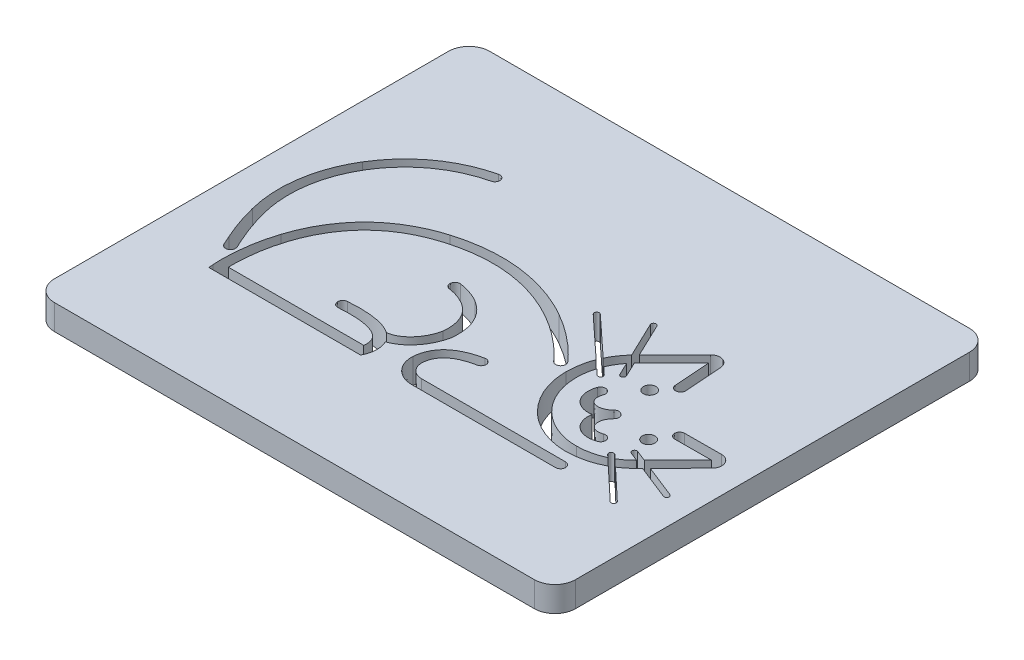
from build123d import *

# Parameters (mm, degrees)
BOSS_EXTRUDE2_DEPTH = 1
CUT_EXTRUDE1_DEPTH  = 1
SKETCH3_R           = 0.25
CUT_EXTRUDE2_DEPTH  = 14.515784617


# Read off the part's stored shape, not the designer's step: Cut-Extrude1
with BuildPart() as part:
    # Sketch1 → Boss-Extrude2 (new body)
    with BuildSketch(Plane(origin=(0, 0, 0), x_dir=(1, 0, 0), z_dir=(0, 1, 0))):
        with BuildLine():
            Line((-9.525, -8.640451655), (9.525, -8.640451655))
            ThreePointArc((9.525, -8.640451655), (10.104827561, -8.400279216), (10.345, -7.820451655))
            Line((10.345, -7.820451655), (10.345, 7.820451655))
            ThreePointArc((10.345, 7.820451655), (10.104827561, 8.400279216), (9.525, 8.640451655))
            Line((9.525, 8.640451655), (-9.525, 8.640451655))
            ThreePointArc((-9.525, 8.640451655), (-10.104827561, 8.400279216), (-10.345, 7.820451655))
            Line((-10.345, 7.820451655), (-10.345, -7.820451655))
            ThreePointArc((-10.345, -7.820451655), (-10.104827561, -8.400279216), (-9.525, -8.640451655))
        make_face()
    extrude(amount=BOSS_EXTRUDE2_DEPTH)

    # Cut-Extrude1 outline → Cut-Extrude1 (cut)
    with BuildSketch(Plane(origin=(0, 0, 0), x_dir=(1, 0, 0), z_dir=(0, 1, 0))):
        with BuildLine():
            add(Edge.make_bspline(
                [(-7.911398687, -3.362471499), (-7.931267172, -3.378366523), (-7.959083021, -3.382339687), (-7.986898722, -3.382339687)],
                knots=[12, 12, 12, 12, 13, 13, 13, 13], degree=3))
            add(Edge.make_bspline(
                [(-7.812056412, -3.10020833), (-7.768345834, -3.199550457), (-7.812056412, -3.318760773), (-7.911398687, -3.362471499)],
                knots=[11, 11, 11, 11, 12, 12, 12, 12], degree=3))
            Line((-7.812056412, -3.10020833), (-7.971003993, -2.750523709))
            add(Edge.make_bspline(
                [(-8.44784659, -1.379600929), (-8.332609586, -1.844522702), (-8.169688396, -2.305470126), (-7.971003993, -2.750523709)],
                knots=[9, 9, 9, 9, 10, 10, 10, 10], degree=3))
            add(Edge.make_bspline(
                [(-7.915372295, 2.101350248), (-8.55513623, 1.048322631), (-8.745873268, -0.191468564), (-8.44784659, -1.379600929)],
                knots=[8, 8, 8, 8, 9, 9, 9, 9], degree=3))
            add(Edge.make_bspline(
                [(-5.030474178, 4.203431726), (-6.242449377, 3.913352264), (-7.267660996, 3.166299134), (-7.915372295, 2.101350248)],
                knots=[7, 7, 7, 7, 8, 8, 8, 8], degree=3))
            add(Edge.make_bspline(
                [(-4.883447569, 4.44185295), (-4.859605328, 4.33456331), (-4.923184538, 4.227273671), (-5.030474178, 4.203431726)],
                knots=[6, 6, 6, 6, 7, 7, 7, 7], degree=3))
            add(Edge.make_bspline(
                [(-5.121868793, 4.588879559), (-5.014579154, 4.612721504), (-4.907289514, 4.54914259), (-4.883447569, 4.44185295)],
                knots=[5, 5, 5, 5, 6, 6, 6, 6], degree=3))
            add(Edge.make_bspline(
                [(-8.253135499, 2.307982016), (-7.54979265, 3.464325516), (-6.437159579, 4.274958152), (-5.121868793, 4.588879559)],
                knots=[4, 4, 4, 4, 5, 5, 5, 5], degree=3))
            add(Edge.make_bspline(
                [(-8.829320371, -1.478943057), (-9.155162861, -0.183521052), (-8.948531057, 1.159586027), (-8.253135499, 2.307982016)],
                knots=[3, 3, 3, 3, 4, 4, 4, 4], degree=3))
            add(Edge.make_bspline(
                [(-8.328635534, -2.917419099), (-8.539241057, -2.452497327), (-8.706136003, -1.971681714), (-8.829320371, -1.478943057)],
                knots=[2, 2, 2, 2, 3, 3, 3, 3], degree=3))
            Line((-8.328635534, -2.917419099), (-8.169687952, -3.26710372))
            add(Edge.make_bspline(
                [(-7.986898722, -3.382339687), (-8.062398312, -3.382340872), (-8.133924739, -3.338630146), (-8.169687952, -3.26710372)],
                knots=[0, 0, 0, 0, 1, 1, 1, 1], degree=3))
        make_face()
        with BuildLine():
            add(Edge.make_bspline(
                [(5.785907104, -3.6008945), (5.773986428, -3.608842012), (5.766038916, -3.608842012), (5.762064568, -3.608842012)],
                knots=[25, 25, 25, 25, 26, 26, 26, 26], degree=3))
            add(Edge.make_bspline(
                [(7.733014461, -2.786288107), (7.21643445, -3.306841281), (6.525012722, -3.596920151), (5.785907104, -3.6008945)],
                knots=[24, 24, 24, 24, 25, 25, 25, 25], degree=3))
            Line((7.733014461, -2.786288107), (9.223147557, -1.280259986))
            add(Edge.make_bspline(
                [(9.302621496, -0.855075775), (9.36620041, -1.002101793), (9.334411545, -1.168997182), (9.223147557, -1.280259986)],
                knots=[22, 22, 22, 22, 23, 23, 23, 23], degree=3))
            add(Edge.make_bspline(
                [(8.941016199, -0.616653959), (9.099964077, -0.616653959), (9.24301693, -0.712022922), (9.302621496, -0.855075775)],
                knots=[21, 21, 21, 21, 22, 22, 22, 22], degree=3))
            Line((8.941016199, -0.616653959), (7.478698804, -0.624601471))
            add(Edge.make_bspline(
                [(7.280014549, -0.823285726), (7.280014549, -0.712022922), (7.367436, -0.624601471), (7.478698804, -0.624601471)],
                knots=[19, 19, 19, 19, 20, 20, 20, 20], degree=3))
            add(Edge.make_bspline(
                [(7.478698804, -1.021969981), (7.371409164, -1.021969981), (7.280014549, -0.93454853), (7.280014549, -0.823285726)],
                knots=[18, 18, 18, 18, 19, 19, 19, 19], degree=3))
            Line((7.478698804, -1.021969981), (8.929095523, -1.014022469))
            Line((8.929095523, -1.014022469), (7.446909939, -2.512103077))
            add(Edge.make_bspline(
                [(5.78193394, -3.211472318), (6.413749918, -3.207499154), (7.005830703, -2.961129825), (7.446909939, -2.512103077)],
                knots=[15, 15, 15, 15, 16, 16, 16, 16], degree=3))
            Line((5.78193394, -3.211472318), (5.770013264, -3.211472318))
            add(Edge.make_bspline(
                [(4.109011614, -2.531971266), (4.554065198, -2.969077337), (5.14217045, -3.211472318), (5.770013264, -3.211472318)],
                knots=[13, 13, 13, 13, 14, 14, 14, 14], degree=3))
            add(Edge.make_bspline(
                [(3.409642374, -0.866995268), (3.413615538, -1.49881243), (3.659984866, -2.090890846), (4.109011614, -2.531971266)],
                knots=[12, 12, 12, 12, 13, 13, 13, 13], degree=3))
            add(Edge.make_bspline(
                [(4.089143425, 0.805928243), (3.64806419, 0.360875252), (3.40566921, -0.235178105), (3.409642374, -0.866995268)],
                knots=[11, 11, 11, 11, 12, 12, 12, 12], degree=3))
            Line((4.089143425, 0.805928243), (5.539540144, 2.268245638))
            Line((5.539540144, 2.268245638), (5.64285662, 0.8377177))
            add(Edge.make_bspline(
                [(5.857435899, 0.654927878), (5.746173096, 0.646980365), (5.650804132, 0.73042806), (5.64285662, 0.8377177)],
                knots=[8, 8, 8, 8, 9, 9, 9, 9], degree=3))
            add(Edge.make_bspline(
                [(6.04022513, 0.869507157), (6.048172642, 0.758243761), (5.964725539, 0.666849146), (5.857435899, 0.654927878)],
                knots=[7, 7, 7, 7, 8, 8, 8, 8], degree=3))
            Line((6.04022513, 0.869507157), (5.93293549, 2.331824552))
            add(Edge.make_bspline(
                [(5.702461186, 2.669587904), (5.841540875, 2.613956502), (5.928961142, 2.482824326), (5.93293549, 2.331824552)],
                knots=[5, 5, 5, 5, 6, 6, 6, 6], degree=3))
            add(Edge.make_bspline(
                [(5.289197651, 2.586140209), (5.396487291, 2.693429849), (5.559408333, 2.729193062), (5.702461186, 2.669587904)],
                knots=[4, 4, 4, 4, 5, 5, 5, 5], degree=3))
            Line((5.289197651, 2.586140209), (3.803037719, 1.088059601))
            add(Edge.make_bspline(
                [(3.008299515, -0.866995268), (3.004326351, -0.12788965), (3.286457709, 0.567506427), (3.803037719, 1.088059601)],
                knots=[2, 2, 2, 2, 3, 3, 3, 3], degree=3))
            add(Edge.make_bspline(
                [(3.822905908, -2.814102624), (3.302352734, -2.297522614), (3.012273864, -1.606100885), (3.008299515, -0.866995268)],
                knots=[1, 1, 1, 1, 2, 2, 2, 2], degree=3))
            add(Edge.make_bspline(
                [(5.762064568, -3.608842012), (5.030906462, -3.608840828), (4.339484734, -3.32670947), (3.822905908, -2.814102624)],
                knots=[0, 0, 0, 0, 1, 1, 1, 1], degree=3))
        make_face()
        with BuildLine():
            add(Edge.make_bspline(
                [(5.525040096, -1.207367589), (5.543002589, -1.21678476), (5.559965599, -1.229161154), (5.575300989, -1.244496773)],
                knots=[2.80703588, 2.80703588, 2.80703588, 2.80703588, 3, 3, 3, 3], degree=3))
            add(Edge.make_bspline(
                [(5.273300258, -1.232574912), (5.343224173, -1.162650998), (5.446984943, -1.154248557), (5.525040096, -1.207367589)],
                knots=[6, 6, 6, 6, 6.879834515, 6.879834515, 6.879834515, 6.879834515], degree=3))
            add(Edge.make_bspline(
                [(4.597773555, -1.339864552), (4.752747084, -1.494838082), (5.062695327, -1.443181028), (5.273300258, -1.232574912)],
                knots=[5, 5, 5, 5, 6, 6, 6, 6], degree=3))
            add(Edge.make_bspline(
                [(4.542142153, -0.910705993), (4.482536403, -1.081574547), (4.502405776, -1.244495589), (4.597773555, -1.339864552)],
                knots=[4, 4, 4, 4, 5, 5, 5, 5], degree=3))
            add(Edge.make_bspline(
                [(4.422931837, -0.656390336), (4.526248313, -0.69215355), (4.581879714, -0.807390702), (4.542142153, -0.910705993)],
                knots=[3, 3, 3, 3, 4, 4, 4, 4], degree=3))
            add(Edge.make_bspline(
                [(4.16861618, -0.775600652), (4.204379393, -0.672284177), (4.319616545, -0.616652775), (4.422931837, -0.656390336)],
                knots=[2, 2, 2, 2, 3, 3, 3, 3], degree=3))
            add(Edge.make_bspline(
                [(4.319616545, -1.618022746), (4.112984778, -1.411390979), (4.057353376, -1.089522059), (4.16861618, -0.775600652)],
                knots=[1, 1, 1, 1, 2, 2, 2, 2], degree=3))
            add(Edge.make_bspline(
                [(4.840167351, -1.824654513), (4.641485465, -1.824654513), (4.45869505, -1.757101251), (4.319616545, -1.618022746)],
                knots=[0, 0, 0, 0, 1, 1, 1, 1], degree=3))
            add(Edge.make_bspline(
                [(4.994458483, -1.810988318), (4.942770079, -1.820063947), (4.891128693, -1.824654513), (4.840167351, -1.824654513)],
                knots=[8.793150624, 8.793150624, 8.793150624, 8.793150624, 9, 9, 9, 9], degree=3))
            add(Edge.make_bspline(
                [(5.185879991, -2.484287376), (5.013484781, -2.309682266), (4.95172902, -2.061317645), (4.994458483, -1.810988318)],
                knots=[1, 1, 1, 1, 1.556206446, 1.556206446, 1.556206446, 1.556206446], degree=3))
            add(Edge.make_bspline(
                [(5.71040633, -2.690917959), (5.507748911, -2.690919144), (5.320986516, -2.619392717), (5.185879991, -2.484287376)],
                knots=[0, 0, 0, 0, 1, 1, 1, 1], degree=3))
            add(Edge.make_bspline(
                [(6.032275249, -2.631312209), (5.921012445, -2.675022935), (5.813722805, -2.690917959), (5.71040633, -2.690917959)],
                knots=[8, 8, 8, 8, 9, 9, 9, 9], degree=3))
            add(Edge.make_bspline(
                [(6.151485565, -2.376996552), (6.187248778, -2.480313028), (6.13559054, -2.595548996), (6.032275249, -2.631312209)],
                knots=[7, 7, 7, 7, 8, 8, 8, 8], degree=3))
            add(Edge.make_bspline(
                [(5.897169908, -2.257786236), (6.000486384, -2.222023023), (6.115722352, -2.273681261), (6.151485565, -2.376996552)],
                knots=[6, 6, 6, 6, 7, 7, 7, 7], degree=3))
            add(Edge.make_bspline(
                [(5.468011349, -2.202154834), (5.563380313, -2.297523798), (5.726301354, -2.317391986), (5.897169908, -2.257786236)],
                knots=[5, 5, 5, 5, 6, 6, 6, 6], degree=3))
            add(Edge.make_bspline(
                [(5.575300989, -1.526628131), (5.364696058, -1.737233062), (5.31303782, -2.047181305), (5.468011349, -2.202154834)],
                knots=[4, 4, 4, 4, 5, 5, 5, 5], degree=3))
            add(Edge.make_bspline(
                [(5.575300989, -1.244496773), (5.654773744, -1.323970712), (5.654774928, -1.447155376), (5.575300989, -1.526628131)],
                knots=[3, 3, 3, 3, 4, 4, 4, 4], degree=3))
        make_face()
        with BuildLine():
            add(Edge.make_bspline(
                [(-1.610512485, -3.419637176), (-1.407538409, -3.815250313), (-1.578009661, -4.226441795), (-1.585285622, -4.244631154)],
                knots=[18.084498357, 18.084498357, 18.084498357, 18.084498357, 19, 19, 19, 19], degree=3))
            add(Edge.make_bspline(
                [(-0.436889041, -1.971681714), (-0.576912761, -2.665287471), (-1.058509094, -3.236140956), (-1.610512485, -3.419637176)],
                knots=[10, 10, 10, 10, 10.819482093, 10.819482093, 10.819482093, 10.819482093], degree=3))
            Line((-0.436889041, -1.971681714), (-0.432915285, -1.951813526))
            add(Edge.make_bspline(
                [(-1.219705977, -0.24710115), (-0.814389955, -0.497443643), (-0.345494426, -0.998128629), (-0.432915285, -1.951813526)],
                knots=[8, 8, 8, 8, 9, 9, 9, 9], degree=3))
            add(Edge.make_bspline(
                [(-2.113786308, 0.062847093), (-2.093918119, 0.062847093), (-1.648864536, 0.019136367), (-1.219705977, -0.24710115)],
                knots=[7, 7, 7, 7, 8, 8, 8, 8], degree=3))
            add(Edge.make_bspline(
                [(-2.328365588, -0.115968973), (-2.316444319, -0.008679334), (-2.221075948, 0.074768361), (-2.113786308, 0.062847093)],
                knots=[6, 6, 6, 6, 7, 7, 7, 7], degree=3))
            add(Edge.make_bspline(
                [(-2.149549521, -0.330548253), (-2.260812917, -0.318627577), (-2.340286856, -0.223258613), (-2.328365588, -0.115968973)],
                knots=[5, 5, 5, 5, 6, 6, 6, 6], degree=3))
            add(Edge.make_bspline(
                [(-1.4303115, -0.58486391), (-1.77999612, -0.366311466), (-2.145575173, -0.334521417), (-2.149549521, -0.330548253)],
                knots=[4, 4, 4, 4, 5, 5, 5, 5], degree=3))
            add(Edge.make_bspline(
                [(-0.830284387, -1.904128452), (-0.778626149, -1.308075687), (-0.981284752, -0.863022104), (-1.4303115, -0.58486391)],
                knots=[3, 3, 3, 3, 4, 4, 4, 4], degree=3))
            add(Edge.make_bspline(
                [(-1.910463057, -3.080754729), (-1.429976569, -3.033642077), (-0.958948595, -2.524744774), (-0.830284387, -1.904128452)],
                knots=[2.047674892, 2.047674892, 2.047674892, 2.047674892, 3, 3, 3, 3], degree=3))
            add(Edge.make_bspline(
                [(-3.750946013, -2.786288107), (-2.897078975, -2.719629653), (-2.281559554, -2.817784993), (-1.910463057, -3.080754729)],
                knots=[17, 17, 17, 17, 17.798810883, 17.798810883, 17.798810883, 17.798810883], degree=3))
            add(Edge.make_bspline(
                [(-3.933735836, -3.000867387), (-3.941683348, -2.889604583), (-3.862209409, -2.794235619), (-3.750946013, -2.786288107)],
                knots=[16, 16, 16, 16, 17, 17, 17, 17], degree=3))
            add(Edge.make_bspline(
                [(-3.719156556, -3.183656617), (-3.830419952, -3.191604129), (-3.925788323, -3.11213019), (-3.933735836, -3.000867387)],
                knots=[15, 15, 15, 15, 16, 16, 16, 16], degree=3))
            add(Edge.make_bspline(
                [(-2.002522912, -3.541288749), (-2.157497034, -3.330683818), (-2.57870808, -3.096235166), (-3.719156556, -3.183656617)],
                knots=[14, 14, 14, 14, 15, 15, 15, 15], degree=3))
            add(Edge.make_bspline(
                [(-1.919075217, -3.970447308), (-1.899207028, -3.859184505), (-1.895233272, -3.692289115), (-2.002522912, -3.541288749)],
                knots=[13, 13, 13, 13, 14, 14, 14, 14], degree=3))
            Line((-1.919075217, -3.970447308), (-7.291502645, -3.970447308))
            add(Edge.make_bspline(
                [(-6.997449723, -1.916050313), (-7.283555281, -2.806156296), (-7.299450158, -3.616789524), (-7.291502645, -3.970447308)],
                knots=[11, 11, 11, 11, 12, 12, 12, 12], degree=3))
            add(Edge.make_bspline(
                [(-3.882077598, 1.155611679), (-5.447710877, 0.682742394), (-6.496765033, -0.350416442), (-6.997449723, -1.916050313)],
                knots=[10, 10, 10, 10, 11, 11, 11, 11], degree=3))
            add(Edge.make_bspline(
                [(0.675743142, 0.639032261), (-0.774653577, 1.453638654), (-2.308497399, 1.628480964), (-3.882077598, 1.155611679)],
                knots=[9, 9, 9, 9, 10, 10, 10, 10], degree=3))
            add(Edge.make_bspline(
                [(2.404298054, -0.747784951), (2.392377378, -0.735864275), (1.760560216, 0.027084472), (0.675743142, 0.639032261)],
                knots=[8, 8, 8, 8, 9, 9, 9, 9], degree=3))
            add(Edge.make_bspline(
                [(2.682456248, -0.775600652), (2.599009145, -0.843153915), (2.471851317, -0.831232054), (2.404298054, -0.747784951)],
                knots=[7, 7, 7, 7, 8, 8, 8, 8], degree=3))
            add(Edge.make_bspline(
                [(2.710271949, -0.497442459), (2.777825211, -0.580889562), (2.765903351, -0.70804739), (2.682456248, -0.775600652)],
                knots=[6, 6, 6, 6, 7, 7, 7, 7], degree=3))
            add(Edge.make_bspline(
                [(0.882374909, 0.976796205), (2.034745245, 0.325111446), (2.682456248, -0.465652409), (2.710271949, -0.497442459)],
                knots=[5, 5, 5, 5, 6, 6, 6, 6], degree=3))
            add(Edge.make_bspline(
                [(-3.99731475, 1.533112592), (-1.895233272, 2.164929163), (-0.182573384, 1.580797074), (0.882374909, 0.976796205)],
                knots=[4, 4, 4, 4, 5, 5, 5, 5], degree=3))
            add(Edge.make_bspline(
                [(-7.3789238, -1.796838812), (-7.005396939, -0.628574635), (-6.11529066, 0.897322266), (-3.99731475, 1.533112592)],
                knots=[3, 3, 3, 3, 4, 4, 4, 4], degree=3))
            add(Edge.make_bspline(
                [(-7.684897843, -4.188999752), (-7.688871599, -4.141315862), (-7.784240118, -3.05252444), (-7.3789238, -1.796838812)],
                knots=[2, 2, 2, 2, 3, 3, 3, 3], degree=3))
            Line((-7.684897843, -4.188999752), (-7.669003114, -4.367815818))
            Line((-7.669003114, -4.367815818), (-1.64489078, -4.367815818))
            Line((-1.64489078, -4.367815818), (-1.585285622, -4.244631154))
        make_face()
        with BuildLine():
            add(Edge.make_bspline(
                [(6.294540787, -4.169130379), (6.294540787, -4.280393183), (6.207119335, -4.367814634), (6.095855347, -4.367815818)],
                knots=[11, 11, 11, 11, 12, 12, 12, 12], degree=3))
            add(Edge.make_bspline(
                [(6.095856532, -3.970446124), (6.207119335, -3.970446124), (6.294540787, -4.057867575), (6.294540787, -4.169130379)],
                knots=[10, 10, 10, 10, 11, 11, 11, 11], degree=3))
            Line((6.095856532, -3.970446124), (0.377717943, -3.970446124))
            add(Edge.make_bspline(
                [(-0.015677402, -3.79957757), (0.087638481, -3.910841558), (0.226717578, -3.970446124), (0.377717943, -3.970446124)],
                knots=[8, 8, 8, 8, 9, 9, 9, 9], degree=3))
            add(Edge.make_bspline(
                [(-0.158730255, -3.398234712), (-0.166677768, -3.545260729), (-0.118993286, -3.688313582), (-0.015677402, -3.79957757)],
                knots=[7, 7, 7, 7, 8, 8, 8, 8], degree=3))
            add(Edge.make_bspline(
                [(1.017481434, -2.396864741), (0.274401468, -2.543890758), (-0.122967042, -2.881654702), (-0.158730255, -3.398234712)],
                knots=[6, 6, 6, 6, 7, 7, 7, 7], degree=3))
            add(Edge.make_bspline(
                [(1.172454963, -2.162417273), (1.192323152, -2.269706913), (1.124771074, -2.373022204), (1.017481434, -2.396864741)],
                knots=[5, 5, 5, 5, 6, 6, 6, 6], degree=3))
            add(Edge.make_bspline(
                [(0.938007495, -2.007443743), (1.045297135, -1.987575555), (1.148612426, -2.055127633), (1.172454963, -2.162417273)],
                knots=[4, 4, 4, 4, 5, 5, 5, 5], degree=3))
            add(Edge.make_bspline(
                [(-0.556099949, -3.374393359), (-0.520336736, -2.877682722), (-0.23423103, -2.241892396), (0.938007495, -2.007443743)],
                knots=[3, 3, 3, 3, 4, 4, 4, 4], degree=3))
            add(Edge.make_bspline(
                [(-0.305757457, -4.0737626), (-0.484573523, -3.883025857), (-0.571994382, -3.636656529), (-0.556099949, -3.374393359)],
                knots=[2, 2, 2, 2, 3, 3, 3, 3], degree=3))
            add(Edge.make_bspline(
                [(0.377716759, -4.367815818), (0.119426754, -4.367815818), (-0.130915147, -4.260526178), (-0.305757457, -4.0737626)],
                knots=[1, 1, 1, 1, 2, 2, 2, 2], degree=3))
            Line((0.377716759, -4.367815818), (6.095855347, -4.367815818))
        make_face()
    extrude(amount=CUT_EXTRUDE1_DEPTH, mode=Mode.SUBTRACT)

    # Sketch3 → Cut-Extrude2 (cut, through all)
    with BuildSketch(Plane(origin=(0, 0, 0), x_dir=(1, 0, 0), z_dir=(0, 1, 0))):
        with Locations(Location((5.302041895, 0.165218261, 0), (0, 0, 270))):
            Circle(SKETCH3_R)
        with Locations(Location((6.977740155, -1.552930552, 0), (0, 0, 270))):
            Circle(SKETCH3_R)
        with BuildLine():
            Line((4.170570643, 0.110331996), (3.059189861, 2.430903251))
            ThreePointArc((3.059189861, 2.430903251), (3.106185609, 2.564287656), (3.239570015, 2.517291909))
            Line((3.239570015, 2.517291909), (4.350950797, 0.196720654))
            ThreePointArc((4.350950797, 0.196720654), (4.303955049, 0.063336248), (4.170570643, 0.110331996))
        make_face()
        with BuildLine():
            Line((3.73877075, -0.357891748), (1.569300159, 1.654245056))
            ThreePointArc((1.569300159, 1.654245056), (1.563982916, 1.795566417), (1.705304276, 1.80088366))
            Line((1.705304276, 1.80088366), (3.874774867, -0.211253144))
            ThreePointArc((3.874774867, -0.211253144), (3.880092111, -0.352574505), (3.73877075, -0.357891748))
        make_face()
        with BuildLine():
            Line((7.173063822, -2.180899175), (9.29918358, -3.026514987))
            ThreePointArc((9.29918358, -3.026514987), (9.35514695, -3.156392242), (9.225269695, -3.212355612))
            Line((9.225269695, -3.212355612), (7.099149938, -2.366739799))
            ThreePointArc((7.099149938, -2.366739799), (7.043186568, -2.236862545), (7.173063822, -2.180899175))
        make_face()
        with BuildLine():
            Line((6.818019158, -2.736353543), (8.485090332, -4.302905223))
            ThreePointArc((8.485090332, -4.302905223), (8.489484394, -4.4442583), (8.348131318, -4.448652362))
            Line((8.348131318, -4.448652362), (6.681060144, -2.882100682))
            ThreePointArc((6.681060144, -2.882100682), (6.676666082, -2.740747606), (6.818019158, -2.736353543))
        make_face()
    extrude(amount=CUT_EXTRUDE2_DEPTH, mode=Mode.SUBTRACT)


solid = part.part
